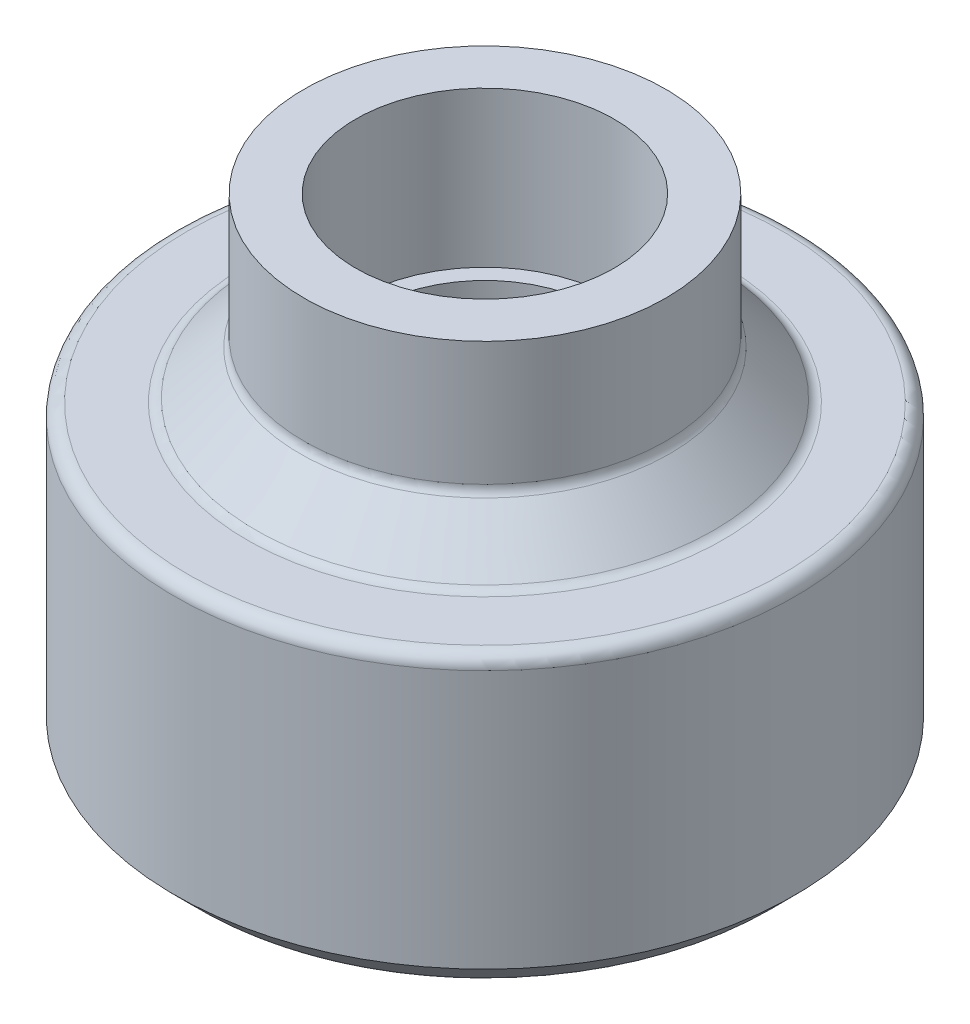
from build123d import *

# Parameters (mm, degrees)
CHAMFER1_SIZE                   = 1.905
FILLET1_R                       = 0.635
F_7_16_0_4375_DOWEL_HOLE1_D     = 11.1125
F_7_16_0_4375_DOWEL_HOLE1_DEPTH = 11.938
F_7_16_0_4375_DOWEL_HOLE1_TIP   = 3.338531814


with BuildPart() as part:
    # Sketch1 → Revolve1 (revolve)
    with BuildSketch(Plane.XY):
        Polygon((0, 0), (6.35, 0), (6.35, 7.62), (8.89, 7.62), (8.89, 1.27), (11.43, -1.27), (15.24, -1.27), (15.24, -16.51), (13.97, -16.51), (0, -5.837068859), align=None)
    revolve(axis=Axis((0, -1033.02, 0), (0, 1, 0)))

    # Chamfer1
    # the kernel refuses this chamfer: 1.905 mm, written as the material it takes off along each edge
    with BuildSketch(Plane(origin=(0, -16.51, 0), x_dir=(1, 0, 0), z_dir=(0, 0, 1))) as chamfer1_piece_1:
        Polygon((15.24, CHAMFER1_SIZE), (15.24 - CHAMFER1_SIZE, 0), (15.24, 0), align=None)
    revolve(axis=Axis((0, -16.51, 0), (0, 1, 0)), mode=Mode.SUBTRACT)

    # Fillet1
    fillet1_edges = [part.edges().sort_by_distance(p)[0] for p in [
        (-13.610020501, -16.234979499, 0),
        (-15.24, -1.27, 0),
        (-11.43, -1.27, 0),
        (-8.89, 1.27, 0),
    ]]
    fillet(fillet1_edges, radius=FILLET1_R)

    # 7/16 (0.4375) Dowel Hole1
    with Locations(Plane(origin=(0, 0, 0), x_dir=(1, 0, 0), z_dir=(0, 1, 0))):
        with Locations((0, 0)):
            Hole(F_7_16_0_4375_DOWEL_HOLE1_D / 2, depth=F_7_16_0_4375_DOWEL_HOLE1_DEPTH)
            with Locations((0, 0, -(F_7_16_0_4375_DOWEL_HOLE1_DEPTH + F_7_16_0_4375_DOWEL_HOLE1_TIP / 2))):  # 118° drill point
                Cone(0, F_7_16_0_4375_DOWEL_HOLE1_D / 2, F_7_16_0_4375_DOWEL_HOLE1_TIP, mode=Mode.SUBTRACT)


solid = part.part
